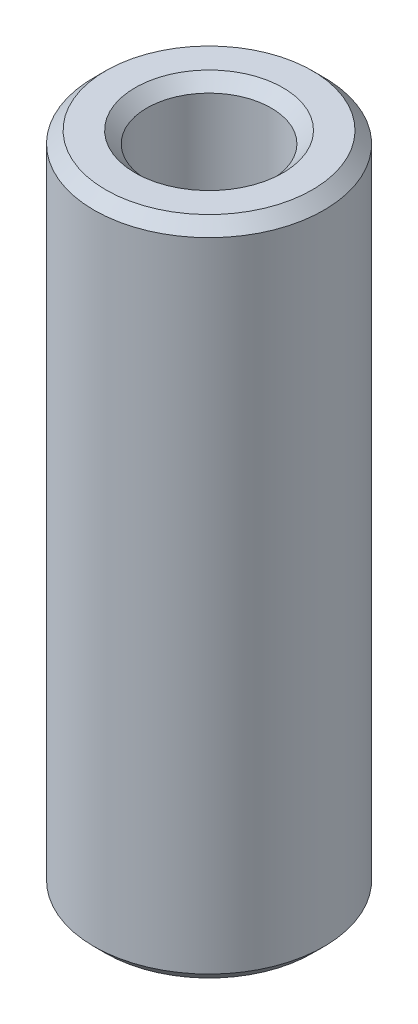
from build123d import *

# Parameters (mm, degrees)
SKETCH1_R           = 5
BOSS_EXTRUDE1_DEPTH = 28.757889188
SKETCH2_R           = 2.703414774
CUT_EXTRUDE1_DEPTH  = 30.614459147
CHAMFER1_SIZE       = 0.509922053


with BuildPart() as part:
    # Sketch1 → Boss-Extrude1 (new body)
    with BuildSketch(Plane(origin=(0, 0, 0), x_dir=(1, 0, 0), z_dir=(0, 1, 0))):
        Circle(SKETCH1_R)
    extrude(amount=BOSS_EXTRUDE1_DEPTH)

    # Sketch2 → Cut-Extrude1 (cut, through all)
    with BuildSketch(Plane(origin=(0, 0, 0), x_dir=(1, 0, 0), z_dir=(0, 1, 0))):
        Circle(SKETCH2_R)
    extrude(amount=CUT_EXTRUDE1_DEPTH, mode=Mode.SUBTRACT)

    # Chamfer1
    chamfer1_edges = [part.edges().sort_by_distance(p)[0] for p in [
        (-2.703414774, 28.757889188, 0),
        (-2.703414774, 0, 0),
        (-5, 0, 0),
        (-5, 28.757889188, 0),
    ]]
    chamfer(chamfer1_edges, length=CHAMFER1_SIZE)


solid = part.part
